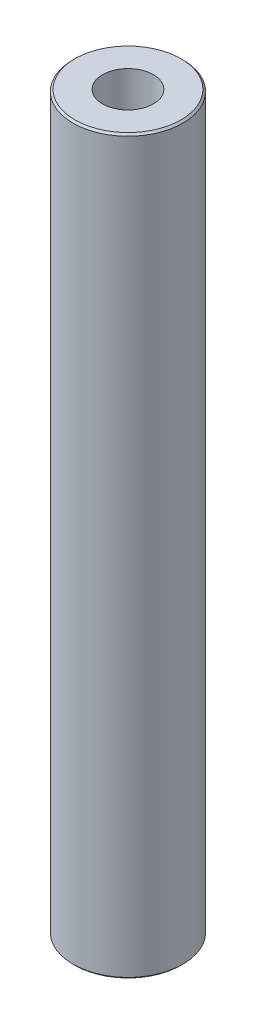
from build123d import *

# Parameters (mm, degrees)
SKETCH1_R           = 45
BOSS_EXTRUDE1_DEPTH = 600
SKETCH2_R           = 20.806305421
CUT_EXTRUDE1_DEPTH  = 604.365560834
CHAMFER1_SIZE       = 1.542280363


with BuildPart() as part:
    # Sketch1 → Boss-Extrude1 (new body)
    with BuildSketch(Plane(origin=(0, 0, 0), x_dir=(1, 0, 0), z_dir=(0, 1, 0))):
        Circle(SKETCH1_R)
    extrude(amount=BOSS_EXTRUDE1_DEPTH)

    # Sketch2 → Cut-Extrude1 (cut, through all)
    with BuildSketch(Plane(origin=(0, 0, 0), x_dir=(1, 0, 0), z_dir=(0, 1, 0))):
        Circle(SKETCH2_R)
    extrude(amount=CUT_EXTRUDE1_DEPTH, mode=Mode.SUBTRACT)

    # Chamfer1
    chamfer1_edges = [part.edges().sort_by_distance(p)[0] for p in [
        (-45, 600, 0),
        (-45, 0, 0),
    ]]
    chamfer(chamfer1_edges, length=CHAMFER1_SIZE)


solid = part.part
